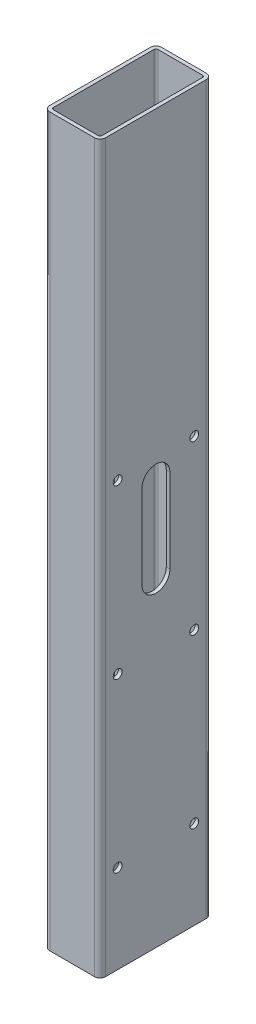
from build123d import *

# Parameters (mm, degrees)
EXTRUDE_THIN1_DEPTH = 330.2
CUT_EXTRUDE1_REACH  = 334.148
CUT_EXTRUDE4_REACH  = 334.148
SKETCH4_R           = 2.0193
CUT_EXTRUDE3_DEPTH  = 333.148099498


with BuildPart() as part:
    # Sketch1 → Extrude-Thin1 (new body)
    with BuildSketch(Plane(origin=(0, 0, 0), x_dir=(1, 0, 0), z_dir=(0, 1, 0))):
        with BuildLine():
            Line((-10.16, 25.4), (10.16, 25.4))
            ThreePointArc((10.16, 25.4), (11.956051224, 24.656051224), (12.7, 22.86))
            Line((12.7, 22.86), (12.7, -22.86))
            ThreePointArc((12.7, -22.86), (11.956051224, -24.656051224), (10.16, -25.4))
            Line((10.16, -25.4), (-10.16, -25.4))
            ThreePointArc((-10.16, -25.4), (-11.956051224, -24.656051224), (-12.7, -22.86))
            Line((-12.7, -22.86), (-12.7, 22.86))
            ThreePointArc((-12.7, 22.86), (-11.956051224, 24.656051224), (-10.16, 25.4))
        make_face()
        with BuildLine():
            Line((-10.16, 23.749), (10.16, 23.749))
            ThreePointArc((10.16, 23.749), (10.788617928, 23.488617928), (11.049, 22.86))
            Line((11.049, 22.86), (11.049, -22.86))
            ThreePointArc((11.049, -22.86), (10.788617928, -23.488617928), (10.16, -23.749))
            Line((10.16, -23.749), (-10.16, -23.749))
            ThreePointArc((-10.16, -23.749), (-10.788617928, -23.488617928), (-11.049, -22.86))
            Line((-11.049, -22.86), (-11.049, 22.86))
            ThreePointArc((-11.049, 22.86), (-10.788617928, 23.488617928), (-10.16, 23.749))
        make_face(mode=Mode.SUBTRACT)
    extrude(amount=-EXTRUDE_THIN1_DEPTH)

    # Sketch2 → Cut-Extrude1 (cut, up to next)
    with BuildSketch(Plane.ZY.offset(12.7), mode=Mode.PRIVATE) as cut_extrude1_sk1:
        with BuildLine():
            Line((6.6675, -146.241552074), (6.6675, -281.392048969))
            ThreePointArc((6.6675, -281.392048969), (0, -288.059548969), (-6.6675, -281.392048969))
            Line((-6.6675, -281.392048969), (-6.6675, -146.241552074))
            ThreePointArc((-6.6675, -146.241552074), (0, -139.574052074), (6.6675, -146.241552074))
        make_face()
    cut_extrude1_tool1 = extrude(cut_extrude1_sk1.sketch, amount=-CUT_EXTRUDE1_REACH, mode=Mode.PRIVATE) & part.part
    add(cut_extrude1_tool1.solids().sort_by_distance((-12.7, -213.816801, 0))[0], mode=Mode.SUBTRACT)

    # Sketch5 → Cut-Extrude4 (cut, up to next)
    with BuildSketch(Plane(origin=(12.7, 0, 0), x_dir=(0, 0, -1), z_dir=(1, 0, 0)), mode=Mode.PRIVATE) as cut_extrude4_sk1:
        with BuildLine():
            Line((6.35, -146.241552074), (6.35, -184.341552074))
            ThreePointArc((6.35, -184.341552074), (0, -190.691552074), (-6.35, -184.341552074))
            Line((-6.35, -184.341552074), (-6.35, -146.241552074))
            ThreePointArc((-6.35, -146.241552074), (0, -139.891552074), (6.35, -146.241552074))
        make_face()
    cut_extrude4_tool1 = extrude(cut_extrude4_sk1.sketch, amount=-CUT_EXTRUDE4_REACH, mode=Mode.PRIVATE) & part.part
    add(cut_extrude4_tool1.solids().sort_by_distance((12.7, -165.291552, 0))[0], mode=Mode.SUBTRACT)

    # Sketch4 → Cut-Extrude3 (cut, through all)
    with BuildSketch(Plane(origin=(12.7, 0, 0), x_dir=(0, 0, -1), z_dir=(1, 0, 0))):
        with Locations((-17.399, -290.016804274)):
            Circle(SKETCH4_R)
        with Locations((17.399, -290.016804274)):
            Circle(SKETCH4_R)
        with Locations((-17.399, -213.816804274)):
            Circle(SKETCH4_R)
        with Locations((17.399, -213.816804274)):
            Circle(SKETCH4_R)
        with Locations((-17.399, -137.616804274)):
            Circle(SKETCH4_R)
        with Locations((17.399, -137.616804274)):
            Circle(SKETCH4_R)
    extrude(amount=-CUT_EXTRUDE3_DEPTH, mode=Mode.SUBTRACT)


solid = part.part
